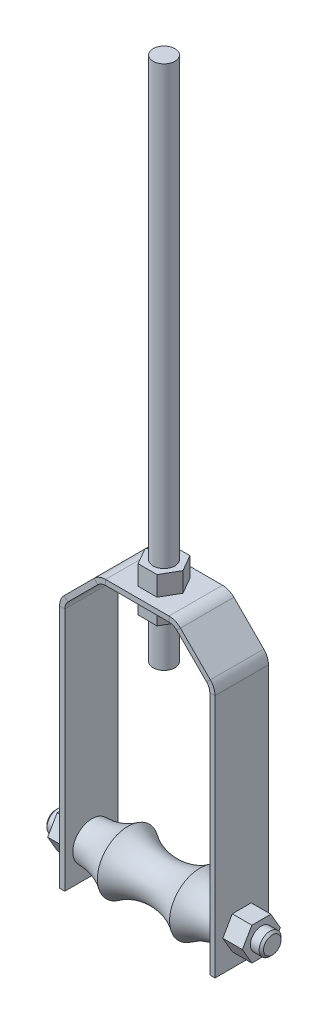
from build123d import *

# Parameters (mm, degrees)
BASE_FLANGE1_DEPTH                = 15.50124711
F_1_2_CLEARANCE_HOLE2_D           = 13.09624
F_1_2_CLEARANCE_HOLE2_ON_FACE_2_D = 13.09624
NUT_SKETCH_R                      = 5.35813
NUT_DEPTH                         = 11.3792
BODY_MOVE_COPY3_ANGLE             = 158.9094188
ROLLER_SKETCH_W                   = 125.67158
ROLLER_SKETCH_H                   = 6.35
CHAMFER1_SIZE                     = 1.27
ROD_SKETCH_W                      = 6.35
ROD_SKETCH_H                      = 304.8


with BuildPart() as part:
    # Base-Flange1: sheet metal written as solids
    # Sketch1 → Base-Flange1 (new, symmetric)
    with BuildSketch(Plane.XY):
        with BuildLine():
            Line((-42.06875, -65.340710983), (-42.06875, 76.485028879))
            ThreePointArc((-42.06875, 76.485028879), (-41.585385031, 78.915068674), (-40.208878061, 80.975156939))
            Line((-40.208878061, 80.975156939), (-22.894246939, 98.289788061))
            ThreePointArc((-22.894246939, 98.289788061), (-20.834158674, 99.666295031), (-18.404118879, 100.14966))
            Line((-18.404118879, 100.14966), (18.404118879, 100.14966))
            ThreePointArc((18.404118879, 100.14966), (20.834158674, 99.666295031), (22.894246939, 98.289788061))
            Line((22.894246939, 98.289788061), (40.208878061, 80.975156939))
            ThreePointArc((40.208878061, 80.975156939), (41.585385031, 78.915068674), (42.06875, 76.485028879))
            Line((42.06875, 76.485028879), (42.06875, -65.340710983))
            Line((42.06875, -65.340710983), (45.10659, -65.340710983))
            Line((45.10659, -65.340710983), (45.10659, 76.485028879))
            ThreePointArc((45.10659, 76.485028879), (44.39198323, 80.077599713), (42.356955325, 83.123234204))
            Line((42.356955325, 83.123234204), (25.042324204, 100.437865325))
            ThreePointArc((25.042324204, 100.437865325), (21.996689713, 102.47289323), (18.404118879, 103.1875))
            Line((18.404118879, 103.1875), (-18.404118879, 103.1875))
            ThreePointArc((-18.404118879, 103.1875), (-21.996689713, 102.47289323), (-25.042324204, 100.437865325))
            Line((-25.042324204, 100.437865325), (-42.356955325, 83.123234204))
            ThreePointArc((-42.356955325, 83.123234204), (-44.39198323, 80.077599713), (-45.10659, 76.485028879))
            Line((-45.10659, 76.485028879), (-45.10659, -65.340710983))
            Line((-45.10659, -65.340710983), (-42.06875, -65.340710983))
        make_face()
    extrude(amount=BASE_FLANGE1_DEPTH, both=True)

    # 1/2 Clearance Hole2 (through all)
    with Locations(Plane.ZX.offset(103.1875)):
        with Locations((0, 0)):
            Hole(F_1_2_CLEARANCE_HOLE2_D / 2)

    # 1/2 Clearance Hole2 on face 2 (through all)
    with Locations(Plane(origin=(45.10659, -47.625, 0), x_dir=(0, 0, 1), z_dir=(1, 0, 0))):
        with Locations((0, 0)):
            Hole(F_1_2_CLEARANCE_HOLE2_ON_FACE_2_D / 2)


with BuildPart() as body_2:
    # Nut_Sketch → Nut (new body)
    with BuildSketch(Plane(origin=(0, 103.1875, 0), x_dir=(1, 0, 0), z_dir=(0, 1, 0))):
        Polygon((10.998522628, 0), (5.499261314, 9.525), (-5.499261314, 9.525), (-10.998522628, 0), (-5.499261314, -9.525), (5.499261314, -9.525), align=None)
        with Locations(Location((0, 0, 0), (0, 0, 270))):
            Circle(NUT_SKETCH_R, mode=Mode.SUBTRACT)
    extrude(amount=NUT_DEPTH)


with BuildPart() as body_3:
    # Body-Move/Copy1: read off the stored shape, not the designer's step
    # Body-Move/Copy1: copy of body 2
    add(body_2.part.moved(Location((0, -64.9213035, 0))))


with BuildPart() as body_4:
    # Body-Move_Copy1 2: copy of body 2
    add(body_2.part.moved(Location((0, -32.4606518, 0))))


with BuildPart() as body_4_1:
    # Body-Move/Copy2: read off the stored shape, not the designer's step
    # Body-Move/Copy2: moved
    add(body_4.part.moved(Location((0, 18.0436118, 0))))


with BuildPart() as body_3_1:
    # Body-Move/Copy3: read off the stored shape, not the designer's step
    # Body-Move/Copy3: moved
    add(body_3.part.moved(Location((-41.2444599, 6.8403935, -23.8125))).rotate(Axis((0, 0, 0), (-0.6947465906, -0.6947465906, -0.1861567879)), BODY_MOVE_COPY3_ANGLE))


with BuildPart() as body_5:
    # Roller_Sketch → Roller (revolve)
    with BuildSketch(Plane.XY):
        with Locations((0, -44.45)):
            Rectangle(ROLLER_SKETCH_W, ROLLER_SKETCH_H)
        with BuildLine():
            Line((41.81475, -36.51243161), (41.81475, -41.021))
            Line((41.81475, -41.021), (0, -41.021))
            Line((0, -41.021), (-41.81475, -41.021))
            Line((-41.81475, -41.021), (-41.81475, -36.51243161))
            ThreePointArc((-41.81475, -36.51243161), (-30.872204648, -34.811948524), (-20.942709632, -29.909289017))
            ThreePointArc((-20.942709632, -29.909289017), (0, -36.5125), (20.942709632, -29.909289017))
            ThreePointArc((20.942709632, -29.909289017), (30.872204648, -34.811948524), (41.81475, -36.51243161))
        make_face()
    revolve(axis=Axis((116.797860072, -47.625, 0), (-1, 0, 0)))

    # Chamfer1
    chamfer1_edges = [body_5.edges().sort_by_distance(p)[0] for p in [
        (-62.83579, -53.975, 0),
        (62.83579, -53.975, 0),
    ]]
    chamfer(chamfer1_edges, length=CHAMFER1_SIZE)


with BuildPart() as body_6:
    # Mirror1: mirrored copy
    add(body_3_1.part.mirror(Plane(origin=(0, 0, 0), x_dir=(0, 0, 1), z_dir=(1, 0, 0))))


with BuildPart() as body_7:
    # Rod_Sketch → Rod (revolve)
    with BuildSketch(Plane.XY, mode=Mode.PRIVATE) as rod_sk:
        with Locations((3.175, 215.77046)):
            Rectangle(ROD_SKETCH_W, ROD_SKETCH_H)
    revolve(rod_sk.sketch.rotate(Axis((0, 0, 0), (0, 1, 0)), 90), axis=Axis((0, 0, 0), (0, 1, 0)))


solid = Compound([part.part, body_2.part, body_4_1.part, body_3_1.part, body_5.part, body_6.part, body_7.part])
